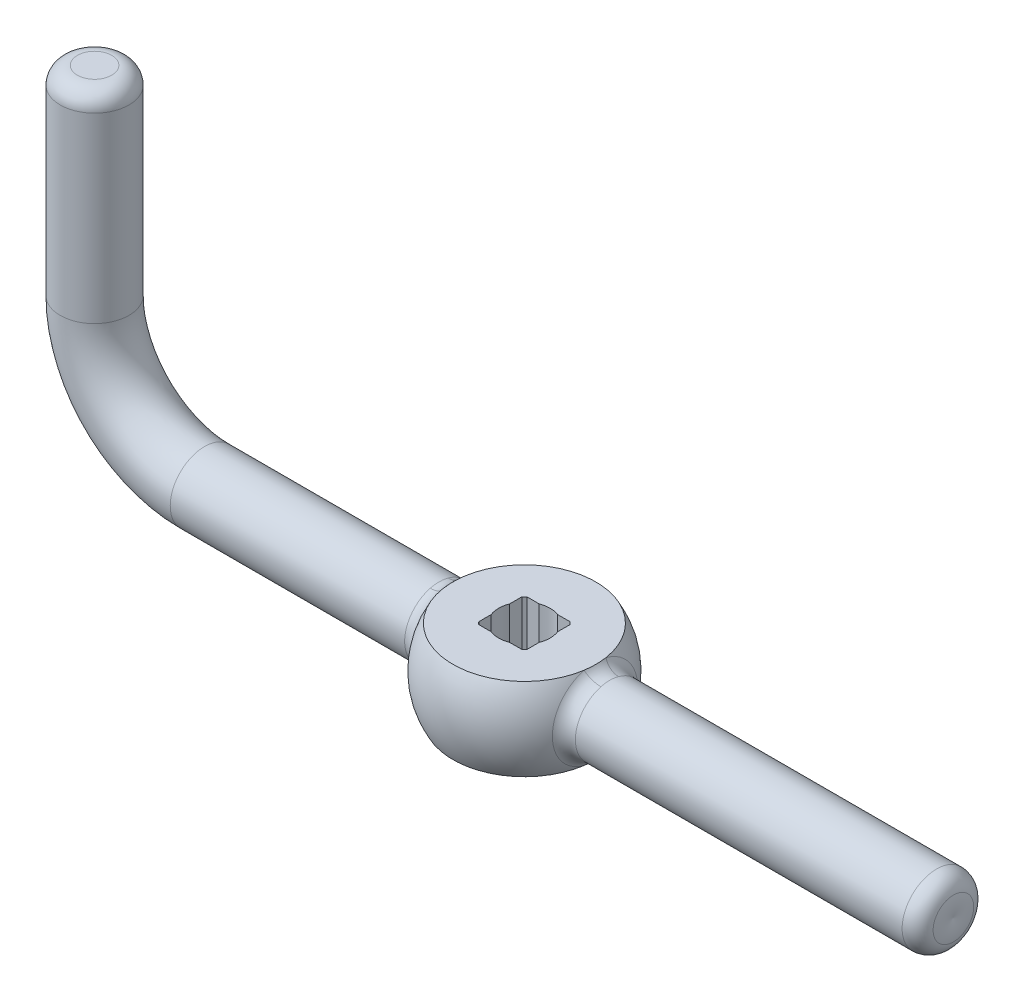
from build123d import *

# Parameters (mm, degrees)
SKETCH_2_R               = 9.999999999999993
FILLET_1_R               = 5
CUT_EXTRUDE_1_DEPTH      = 165.01524327634917
CUT_EXTRUDE_1_DEPTH_BACK = 165.01524327634917


with BuildPart() as part:
    # По траектории1: sweep along a path in Эскиз1
    with BuildLine(Plane.XY) as sweep_1_path:
        Line((-125, 90), (-125, 31.999999999999993))
        ThreePointArc((-125, 31.999999999999993), (-115.62741699796952, 9.372583002030478), (-93, 0))
        Line((-93, 0), (124.99999999999999, 0))
    # Эскиз2 → По траектории1 (sweep)
    with BuildSketch(Plane(origin=(0, 90, 0), x_dir=(1, 0, 0), z_dir=(0, 1, 0))):
        with Locations((-125, 0)):
            Circle(SKETCH_2_R)
    sweep(path=sweep_1_path.line)

    # Эскиз3 → Повернуть1 (revolve)
    with BuildSketch(Plane.XY):
        with BuildLine():
            Line((4.49e-15, 12), (4.49e-15, -12))
            Line((4.49e-15, -12), (-20.784609690826528, -12))
            ThreePointArc((-20.784609690826528, -12), (-24, 2.94e-15), (-20.784609690826528, 12))
            Line((-20.784609690826528, 12), (4.49e-15, 12))
        make_face()
    revolve(axis=Axis((4.49e-15, 20.353481922740002, 0), (-1.1e-16, -1, 0)))

    # Эскиз6 → Вырез-Повернуть1 (revolve, cut)
    with BuildSketch(Plane.XY, mode=Mode.PRIVATE) as cut_revolve_1_sk:
        with BuildLine():
            Line((123.3345611656252, 10.000000000000009), (253.93494063523158, 10.000000000000009))
            Line((253.93494063523158, 10.000000000000009), (253.93494063523158, 0))
            Line((253.93494063523158, 0), (124.58650256653851, 0))
            ThreePointArc((124.58650256653851, 0), (124.89155809301906, 5.116559027883884), (123.3345611656252, 10.000000000000009))
        make_face()
    revolve(cut_revolve_1_sk.sketch.rotate(Axis((-23.23871769146635, 0, 0), (1, 0, 0)), 90), axis=Axis((-23.23871769146635, 0, 0), (1, 0, 0)), mode=Mode.SUBTRACT)

    # Скругление1
    fillet_1_edges = [part.edges().sort_by_distance(p)[0] for p in [
        (-135, 90, 1.22e-15),
    ]]
    fillet(fillet_1_edges, radius=FILLET_1_R)
    fillet_1_2_edges = [part.edges().sort_by_distance(p)[0] for p in [
        (-21.81742422927143, 2.45e-15, 9.999999999999993),
        (-21.81742422927143, -1.22e-15, -9.999999999999993),
    ]]
    fillet(fillet_1_2_edges, radius=FILLET_1_R - 0.0001)  # a hair under: the kernel refuses the full size
    fillet_1_3_edges = [part.edges().sort_by_distance(p)[0] for p in [
        (21.817424229271403, -9.999999999999993, 3.06e-15),
    ]]
    fillet(fillet_1_3_edges, radius=FILLET_1_R)
    fillet_1_4_edges = [part.edges().sort_by_distance(p)[0] for p in [
        (123.33456116562522, 7.071067811865514, 7.071067811865446),
        (123.33456116562522, -7.07106781186551, -7.071067811865451),
    ]]
    fillet(fillet_1_4_edges, radius=FILLET_1_R)

    # Эскиз7 → Вырез-Вытянуть1 (cut, two sides: drawn at the far end of the back side and taken through both)
    with BuildSketch(Plane(origin=(0, 0, 0), x_dir=(1, 0, 0), z_dir=(0, 1, 0)).offset(-CUT_EXTRUDE_1_DEPTH_BACK)):
        with BuildLine():
            ThreePointArc((-6.999999999999877, -6.273754856543386), (-6.646803743153483, -6.646803743153611), (-6.273754856543252, -6.999999999999998))
            Line((-6.273754856543248, -7.000000000000002), (-2.6925824035672585, -7.000000000000006))
            ThreePointArc((-2.692582403567258, -6.999999999999998), (-3.242e-14, -7.5), (2.6925824035671977, -7.000000000000021))
            Line((2.692582403567193, -7.000000000000002), (6.2737548565430865, -7.000000000000002))
            ThreePointArc((6.273754856543118, -7.000000000000118), (6.646803743153469, -6.646803743153625), (6.999999999999976, -6.273754856543277))
            Line((6.999999999999987, -6.273754856543277), (6.999999999999956, -2.6925824035677124))
            ThreePointArc((6.999999999999835, -2.692582403567684), (7.500000000000001, 1.33e-15), (6.999999999999835, 2.6925824035676857))
            Line((6.999999999999997, 2.692582403567716), (6.999999999999997, 6.27375485654329))
            ThreePointArc((6.999999999999971, 6.273754856543282), (6.646803743153472, 6.6468037431536215), (6.273754856543124, 7.000000000000112))
            Line((6.2737548565430865, 6.999999999999998), (2.6925824035671964, 6.999999999999998))
            ThreePointArc((2.6925824035671995, 7.000000000000021), (-3.331e-14, 7.500000000000001), (-2.692582403567263, 6.9999999999999964))
            Line((-2.692582403567263, 7.0000000000000036), (-6.27375485654325, 6.999999999999999))
            ThreePointArc((-6.273754856543249, 7), (-6.646803743153482, 6.646803743153612), (-6.999999999999876, 6.273754856543388))
            Line((-7.000000000000003, 6.273754856543425), (-7.000000000000003, 2.692582403567693))
            ThreePointArc((-6.999999999999842, 2.692582403567664), (-7.5, -2.22e-15), (-6.99999999999984, -2.692582403567666))
            Line((-6.99999999999992, -2.6925824035676946), (-6.999999999999922, -6.273754856543425))
        make_face()
    extrude(amount=CUT_EXTRUDE_1_DEPTH + CUT_EXTRUDE_1_DEPTH_BACK, mode=Mode.SUBTRACT)


solid = part.part
